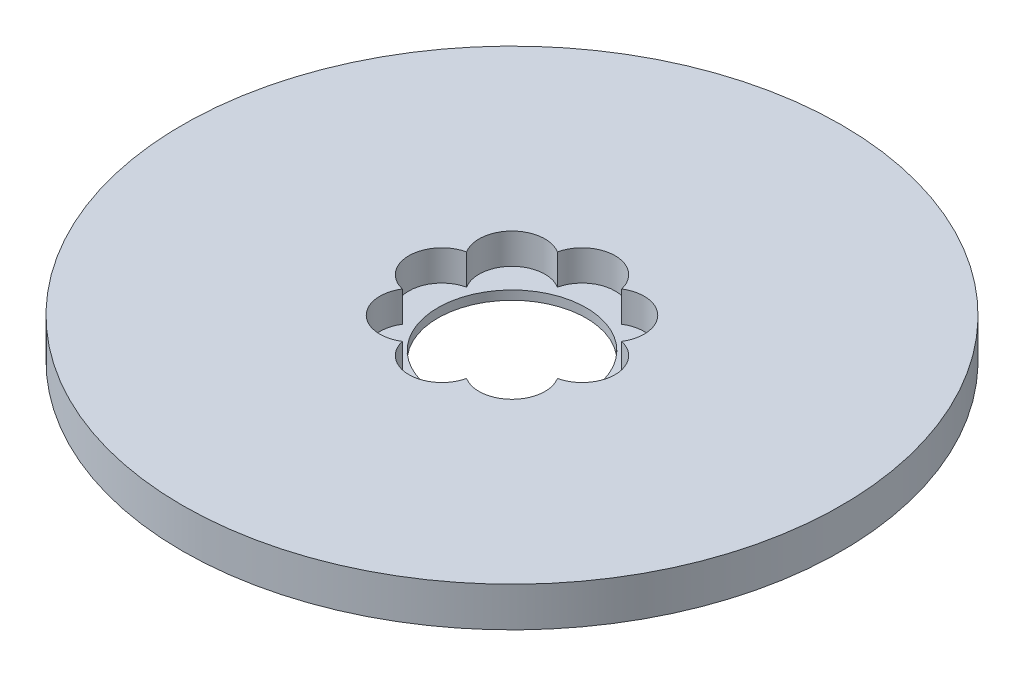
from build123d import *

# Parameters (mm, degrees)
SKETCH1_R           = 100
BOSS_EXTRUDE1_DEPTH = 12
SKETCH2_R           = 22.5
CUT_EXTRUDE1_DEPTH  = 142.929559994
SKETCH3_R           = 10
CUT_EXTRUDE2_DEPTH  = 9.274253005
CIRPATTERN1_COUNT   = 8


with BuildPart() as part:
    # Sketch1 → Boss-Extrude1 (new body)
    with BuildSketch(Plane(origin=(0, 0, 0), x_dir=(1, 0, 0), z_dir=(0, 1, 0))):
        Circle(SKETCH1_R)
    extrude(amount=BOSS_EXTRUDE1_DEPTH)

    # Sketch2 → Cut-Extrude1 (cut, through all)
    with BuildSketch(Plane(origin=(0, 0, 0), x_dir=(1, 0, 0), z_dir=(0, 1, 0))):
        Circle(SKETCH2_R)
    extrude(amount=CUT_EXTRUDE1_DEPTH, mode=Mode.SUBTRACT)

    # Sketch3 → Cut-Extrude2 (cut)
    with BuildSketch(Plane(origin=(0, 12, 0), x_dir=(1, 0, 0), z_dir=(0, 1, 0))):
        with Locations((-21.277260677, 0)):
            Circle(SKETCH3_R)
    cut_extrude2 = extrude(amount=-CUT_EXTRUDE2_DEPTH, mode=Mode.SUBTRACT)

    # CirPattern1: Cut-Extrude2 ×8 about axis
    cirpattern1_axis = Axis((0, 0, 0), (0, 1, 0))
    for i in range(1, CIRPATTERN1_COUNT):
        add(cut_extrude2.rotate(cirpattern1_axis, i * 360 / CIRPATTERN1_COUNT), mode=Mode.SUBTRACT)


solid = part.part
